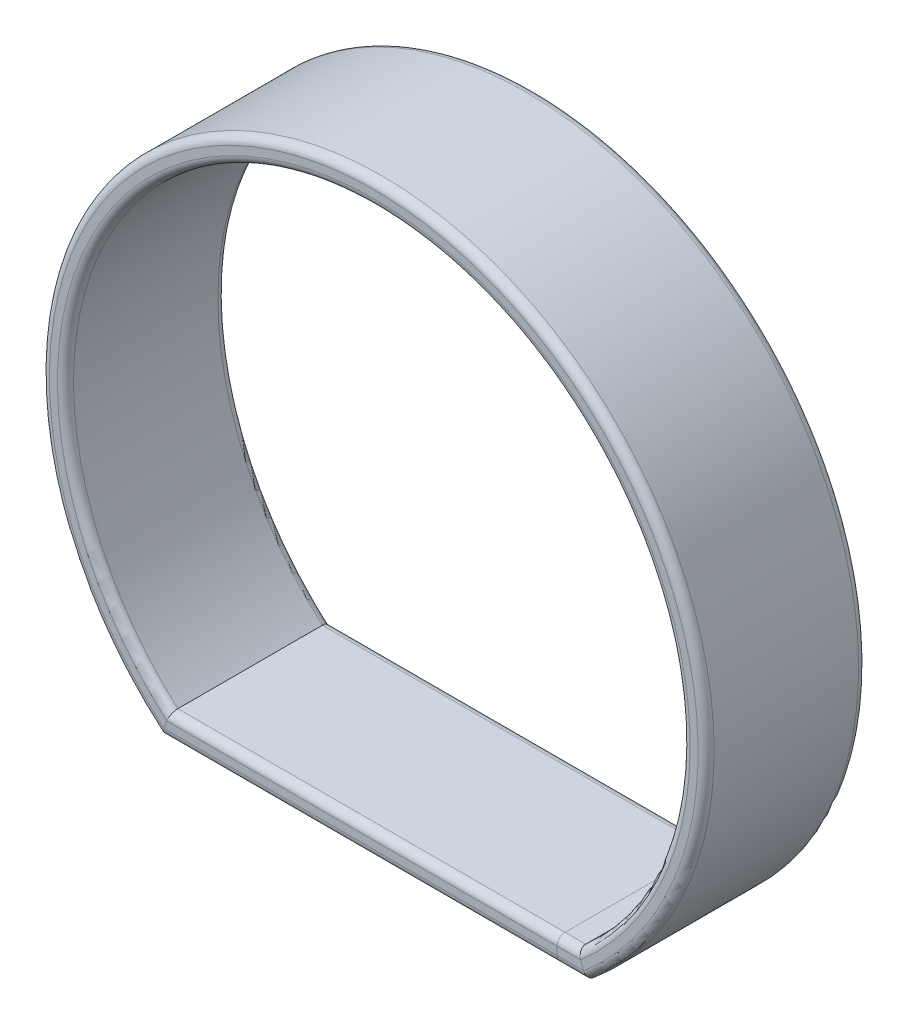
from build123d import *

# Parameters (mm, degrees)
WYCI_GNI_CIE_START            = -10
WYCI_GNI_CIE_PO_CIE_CE1_DEPTH = 20
ZAOKR_GLENIE3_R               = 1


# Read off the part's stored shape, not the designer's step: Wyciągnięcie po ścieżce1
with BuildPart() as part:
    # Wyciągnięcie po ścieżce1 outline → Wyciągnięcie po ścieżce1 (new body)
    with BuildSketch(Plane.XY.offset(WYCI_GNI_CIE_START)):
        with BuildLine():
            Line((-49.378170185, -4.426863255), (3.675802301, -4.426863255))
            ThreePointArc((3.675802301, -4.426863255), (-22.851183942, 68.827583292), (-49.378170185, -4.426863255))
        make_face()
        with BuildLine():
            Line((2.567806336, -1.426863255), (-48.270174221, -1.426863255))
            ThreePointArc((-48.270174221, -1.426863255), (-22.851183943, 65.828623711), (2.567806336, -1.426863255))
        make_face(mode=Mode.SUBTRACT)
    extrude(amount=WYCI_GNI_CIE_PO_CIE_CE1_DEPTH)

    # Zaokrąglenie3
    zaokr_glenie3_edges = [part.edges().sort_by_distance(p)[0] for p in [
        (-22.851183942, -1.426863255, 10),
        (-22.851183942, -4.426863255, 10),
        (-22.851183942, -4.426863255, 10),
        (-22.851183942, -1.426863255, 10),
        (-22.851183942, -1.426863255, -10),
        (-22.851183942, -4.426863255, -10),
        (-22.851183942, -4.426863255, -10),
        (-22.851183942, -1.426863255, -10),
        (-22.851183942, 65.828623711, -10),
        (-22.851183942, 68.827583292, -10),
        (-22.851183942, 68.827583292, 10),
        (-22.851183942, 65.828623711, 10),
    ]]
    fillet(zaokr_glenie3_edges, radius=ZAOKR_GLENIE3_R)


solid = part.part
